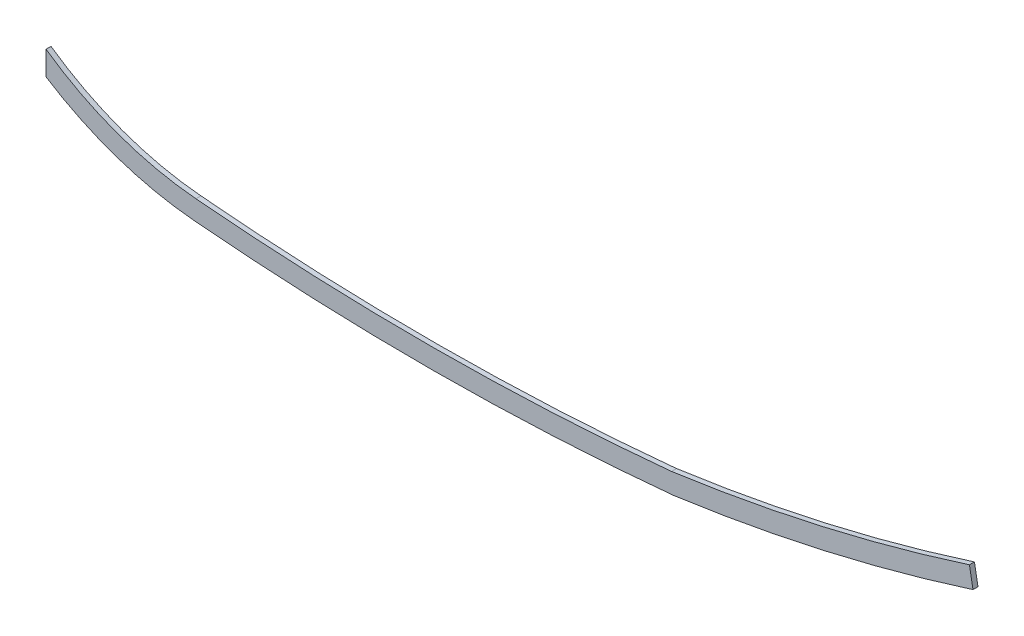
from build123d import *

# Parameters (mm, degrees)
BOSS_EXTRUDE1_DEPTH = 3.175


with BuildPart() as part:
    # Sketch2 → Boss-Extrude1 (new body)
    with BuildSketch(Plane.XY):
        with BuildLine():
            Line((0, -93.726), (0, -78.486))
            ThreePointArc((0, -78.486), (45.497909529, -102.143988159), (95.5675, -113.225336692))
            ThreePointArc((95.5675, -113.225336692), (247.168367606, -119.728946816), (398.720709803, -112.17861051))
            ThreePointArc((398.720709803, -112.17861051), (494.586291489, -94.575813643), (588.578984507, -68.779653684))
            Line((588.578984507, -68.779653684), (590.864339182, -81.353629169))
            ThreePointArc((590.864339182, -81.353629169), (496.464017617, -107.14437724), (400.203586993, -124.765753286))
            ThreePointArc((400.203586993, -124.765753286), (247.115945932, -132.400573942), (93.98, -125.805242584))
            ThreePointArc((93.98, -125.805242584), (45.058861039, -115.423125179), (0, -93.726))
        make_face()
    extrude(amount=BOSS_EXTRUDE1_DEPTH)


solid = part.part
